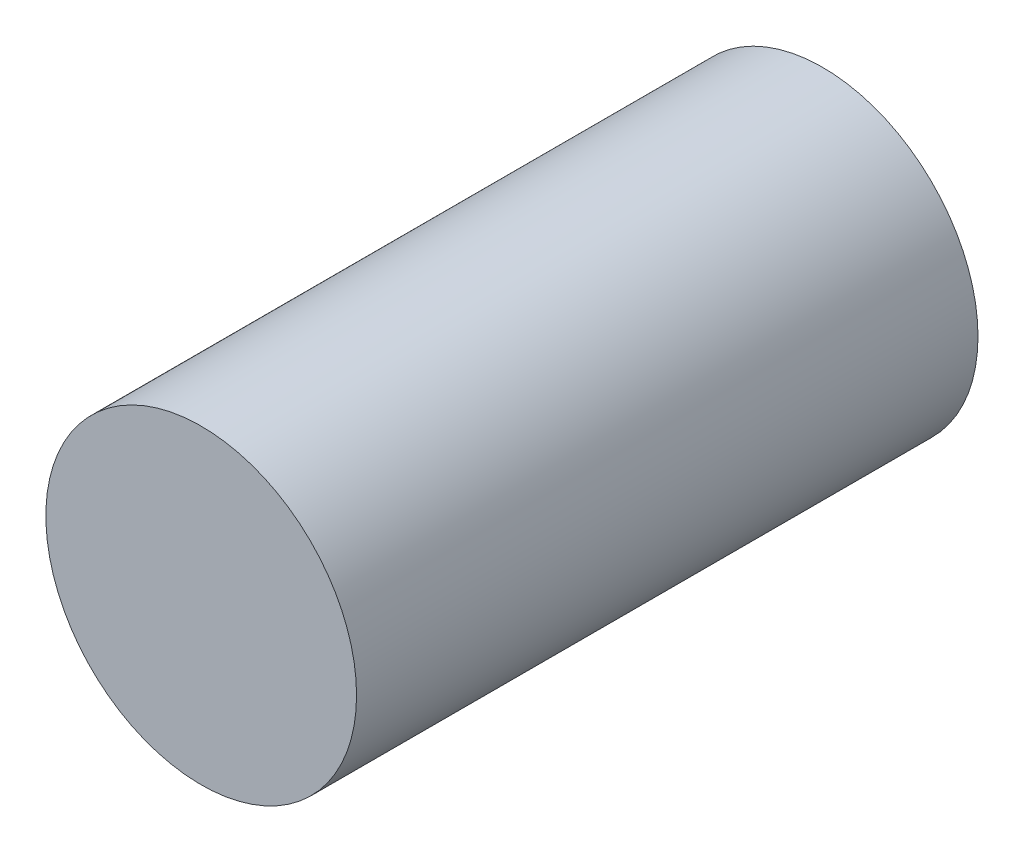
from build123d import *

# Parameters (mm, degrees)
BOSS_EXTRUDE1_DEPTH      = 12.7
BOSS_EXTRUDE1_DEPTH_BACK = 12.7
SKETCH1_R                = 6.35


with BuildPart() as part:
    # Sketch1 → Boss-Extrude1 (new, two sides: drawn at the far end of the back side and taken through both)
    with BuildSketch(Plane.XY.offset(-BOSS_EXTRUDE1_DEPTH_BACK)):
        Circle(SKETCH1_R)
    extrude(amount=BOSS_EXTRUDE1_DEPTH + BOSS_EXTRUDE1_DEPTH_BACK)


solid = part.part
